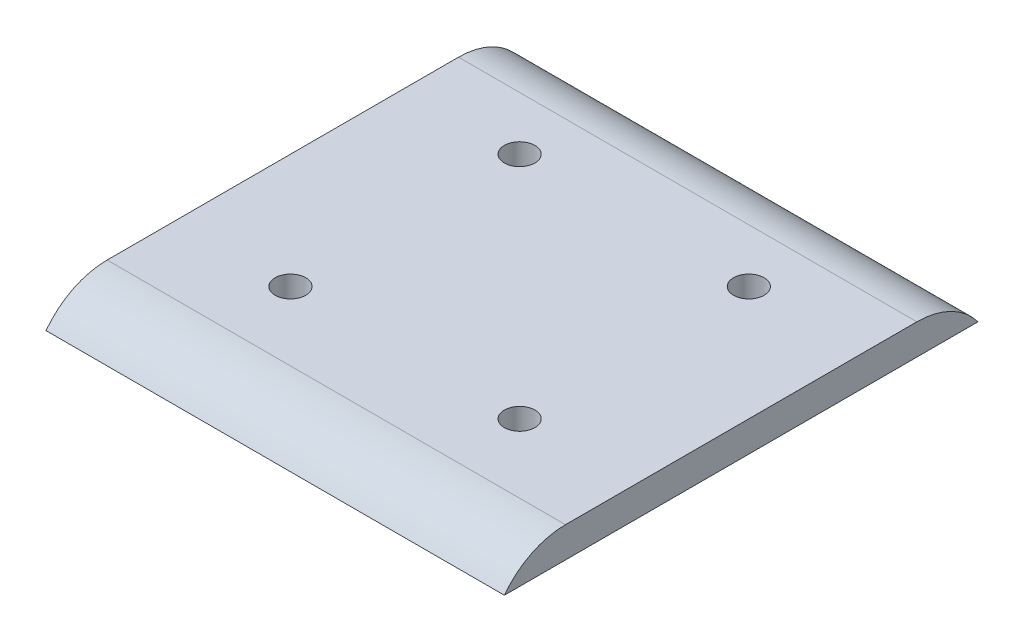
from build123d import *

# Parameters (mm, degrees)
SKETCH1_W           = 30
SKETCH1_H           = 31
BOSS_EXTRUDE1_DEPTH = 2
SKETCH2_R           = 1
CUT_EXTRUDE2_DEPTH  = 4
FILLET2_R           = 5
FILLET3_R           = 5


with BuildPart() as part:
    # Sketch1 → Boss-Extrude1 (new body)
    with BuildSketch(Plane(origin=(0, 0, 0), x_dir=(1, 0, 0), z_dir=(0, 1, 0))):
        with Locations((-2.326732673, -4.50990099)):
            Rectangle(SKETCH1_W, SKETCH1_H)
    extrude(amount=BOSS_EXTRUDE1_DEPTH)

    # Sketch2 → Cut-Extrude2 (cut)
    with BuildSketch(Plane(origin=(0, 0, 0), x_dir=(1, 0, 0), z_dir=(0, 1, 0))):
        with Locations(Location((-9.826732673, 3.49009901, 0), (0, 0, 270))):
            Circle(SKETCH2_R)
        with Locations(Location((-9.826732673, -11.50990099, 0), (0, 0, 270))):
            Circle(SKETCH2_R)
        with Locations(Location((5.173267327, 3.49009901, 0), (0, 0, 270))):
            Circle(SKETCH2_R)
        with Locations(Location((5.173267327, -11.50990099, 0), (0, 0, 270))):
            Circle(SKETCH2_R)
    extrude(amount=CUT_EXTRUDE2_DEPTH, mode=Mode.SUBTRACT)

    # Fillet2
    # the kernel refuses this fillet: 5 mm, written as the material it takes off along each edge
    with BuildSketch(Plane(origin=(22.673267327, 2, 20.00990099), x_dir=(0, 0, -1), z_dir=(-1, 0, 0))) as fillet2_piece_1:
        with BuildLine():
            CenterArc((4, 5), FILLET2_R, 216.869897646, 53.130102354)
            Line((0, 2), (-0.08, 1.94))
            ThreePointArc((-0.08, 1.94), (-0.1, 1), (-0.1, 0))
            Line((-0.1, 0), (0, -0.1))
            Line((0, -0.1), (4, -0.1))
            Line((4, -0.1), (4, 0))
        make_face()
    extrude(amount=50, mode=Mode.SUBTRACT)

    # Fillet3
    # the kernel refuses this fillet: 5 mm, written as the material it takes off along each edge
    with BuildSketch(Plane(origin=(-27.326732673, 2, -10.99009901), x_dir=(0, -1, 0), z_dir=(1, 0, 0))) as fillet3_piece_1:
        with BuildLine():
            CenterArc((5, -4), FILLET3_R, 126.869897646, 53.130102354)
            Line((0, -4), (-0.1, -4))
            Line((-0.1, -4), (-0.1, 0))
            Line((-0.1, 0), (0, 0.1))
            ThreePointArc((0, 0.1), (1, 0.1), (1.94, 0.08))
            Line((1.94, 0.08), (2, 0))
        make_face()
    extrude(amount=50, mode=Mode.SUBTRACT)


solid = part.part
